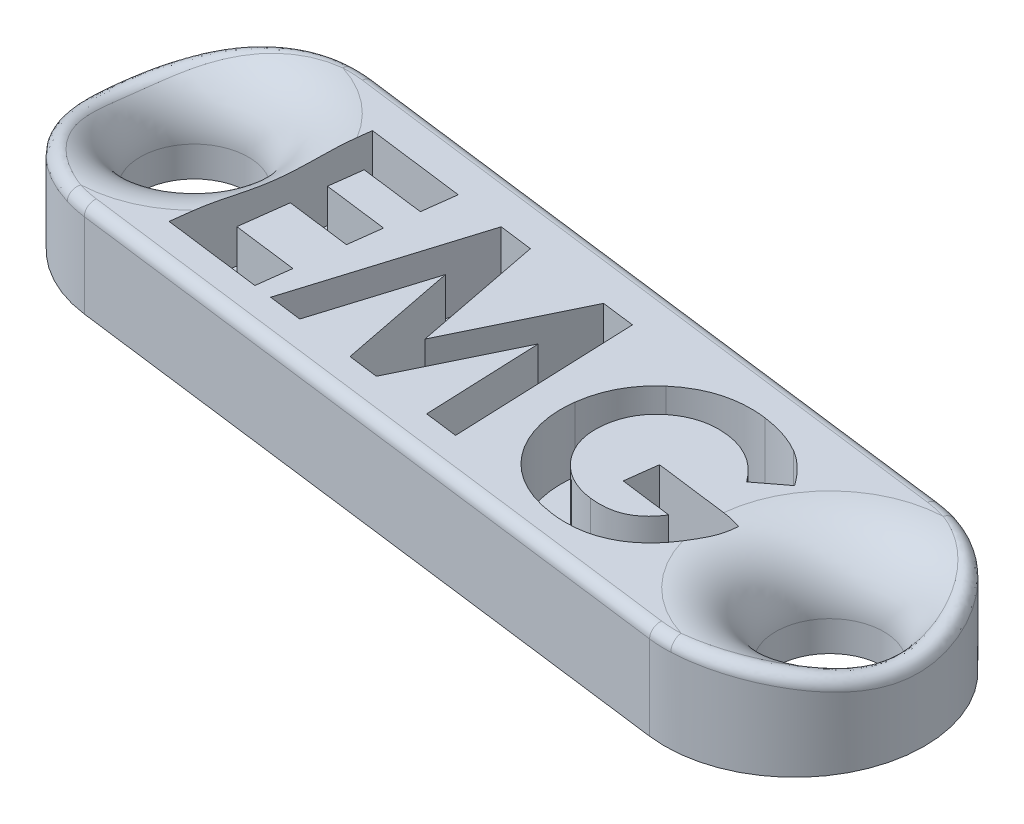
from build123d import *

# Parameters (mm, degrees)
BOSS_EXTRUDE1_DEPTH = 2.2
SKETCH3_R           = 1.25
CUT_EXTRUDE1_DEPTH  = 3
CUT_EXTRUDE2_DEPTH  = 1.5
FILLET1_R           = 1.5
FILLET7_R           = 0.25


with BuildPart() as part:
    # Sketch1 → Boss-Extrude1 (new body)
    with BuildSketch(Plane(origin=(0, 0, 0), x_dir=(1, 0, 0), z_dir=(0, 1, 0))):
        with BuildLine():
            Line((-7.119052023, 3.935857167), (7.880947977, 2.015572456))
            ThreePointArc((7.880947977, 2.015572456), (10.475714811, -1.341090333), (7.119052023, -3.935857167))
            Line((7.119052023, -3.935857167), (-7.880947977, -2.015572456))
            ThreePointArc((-7.880947977, -2.015572456), (-10.475714811, 1.341090333), (-7.119052023, 3.935857167))
        make_face()
    extrude(amount=BOSS_EXTRUDE1_DEPTH)

    # Sketch3 → Cut-Extrude1 (cut)
    with BuildSketch(Plane(origin=(0, 2.2, 0), x_dir=(1, 0, 0), z_dir=(0, 1, 0))):
        with Locations(Location((-8.431191966, 1.079352602, 0), (0, 0, 270))):
            Circle(SKETCH3_R)
        with Locations(Location((8.431191966, -1.079352602, 0), (0, 0, 270))):
            Circle(SKETCH3_R)
    extrude(amount=-CUT_EXTRUDE1_DEPTH, mode=Mode.SUBTRACT)

    # Sketch2 → Cut-Extrude2 (cut)
    with BuildSketch(Plane(origin=(0, 2.2, 0), x_dir=(1, 0, 0), z_dir=(0, 1, 0))):
        Polygon((-6.022160446, 2.793099197), (-3.745217337, 2.501379111), (-3.844436087, 1.723741558), (-5.332717337, 1.913698823), (-5.429392017, 1.159805927), (-3.941110767, 0.969848662), (-4.03863347, 0.207475532), (-5.52691472, 0.397432797), (-5.667686621, -0.699909618), (-4.179405371, -0.889866883), (-4.279472145, -1.670048506), (-6.556415254, -1.378328421), align=None)
        Polygon((-2.607180569, 2.355429305), (-1.830391039, 2.256210555), (-1.238470633, -0.77716952), (0.111582786, 2.006891645), (0.87734801, 1.909368942), (1.046104687, -2.351949167), (0.280339463, -2.254426464), (0.170096408, 0.437200138), (-1.054449533, -2.083125716), (-1.754916947, -1.993235225), (-2.294259896, 0.752664882), (-3.088009896, -1.822782501), (-3.862255355, -1.723563751), align=None)
        with BuildLine():
            Line((5.975449792, 0.564142178), (5.346216352, 0.083312851))
            add(Edge.make_bspline(
                [(5.346216352, 0.083312851), (5.307574927, 0.133842856), (5.232110059, 0.232525554), (5.10508245, 0.364899693), (4.971035347, 0.480853262), (4.828706191, 0.579946602), (4.67820433, 0.661934172), (4.520301115, 0.727428962), (4.354118953, 0.775782284), (4.239796558, 0.794036899), (4.181880081, 0.803284806)],
                knots=[0, 0, 0, 0, 1.082479837, 2.114031708, 3.117474084, 4.096195461, 5.061173401, 6.030140628, 7.002056298, 8, 8, 8, 8], degree=3))
            add(Edge.make_bspline(
                [(4.181880081, 0.803284806), (4.131338155, 0.808485041), (4.032118246, 0.81869373), (3.884415299, 0.817374988), (3.741541892, 0.803304879), (3.602915263, 0.775003934), (3.469143705, 0.733486779), (3.339594998, 0.678896355), (3.215479776, 0.60951165), (3.096961613, 0.527831982), (2.986713986, 0.436267226), (2.887358738, 0.336721443), (2.801468219, 0.229161804), (2.727315391, 0.114999554), (2.664657547, -0.006056471), (2.615822147, -0.135100273), (2.5776535, -0.270981365), (2.563427908, -0.365090604), (2.556219023, -0.412780899)],
                knots=[0, 0, 0, 0, 1.076976059, 2.114234178, 3.126640716, 4.117876873, 5.109693102, 6.092991669, 7.094043356, 8.120151584, 9.141906521, 10.129727869, 11.09792167, 12.055813259, 13.013104218, 13.982930287, 14.97784055, 16, 16, 16, 16], degree=3))
            add(Edge.make_bspline(
                [(2.556219023, -0.412780899), (2.551308987, -0.462479098), (2.54167091, -0.560033397), (2.54371017, -0.705800687), (2.559384068, -0.847396239), (2.590630115, -0.985032443), (2.634277696, -1.118665517), (2.694052433, -1.247833162), (2.766656895, -1.37350643), (2.854169687, -1.492976374), (2.951258872, -1.605016136), (3.058062639, -1.70587502), (3.1727303, -1.794413199), (3.295896042, -1.870332188), (3.426767974, -1.934242102), (3.565908249, -1.984771663), (3.712450731, -2.02484048), (3.813915161, -2.040035127), (3.865567314, -2.047770215)],
                knots=[0, 0, 0, 0, 1.025985715, 2.013942514, 2.990658298, 3.949350306, 4.910434562, 5.875183578, 6.869885119, 7.889283403, 8.914824687, 9.913743918, 10.904039322, 11.887765757, 12.883163006, 13.892507545, 14.927145989, 16, 16, 16, 16], degree=3))
            add(Edge.make_bspline(
                [(3.865567314, -2.047770215), (3.899170825, -2.051570085), (3.965395676, -2.059058762), (4.063407556, -2.063085369), (4.15800045, -2.061571815), (4.249249413, -2.054001598), (4.337009713, -2.040328269), (4.421965411, -2.021948696), (4.50306591, -1.996527313), (4.580906456, -1.964726487), (4.65599503, -1.927430216), (4.728265646, -1.883054396), (4.798026982, -1.831995515), (4.864868677, -1.774069095), (4.929656462, -1.710234736), (4.991661508, -1.639845463), (5.050029029, -1.562163962), (5.08669137, -1.507470829), (5.105377677, -1.479594467)],
                knots=[0, 0, 0, 0, 1.116708228, 2.200777012, 3.237324609, 4.23988476, 5.222331064, 6.169217582, 7.108292401, 8.025482677, 8.944097531, 9.874452197, 10.82313228, 11.796351439, 12.793287391, 13.825325763, 14.891597464, 16, 16, 16, 16], degree=3))
            Line((5.105377677, -1.479594467), (3.897792207, -1.325254189))
            Line((3.897792207, -1.325254189), (3.992770839, -0.579841529))
            Line((3.992770839, -0.579841529), (6.090780989, -0.84866498))
            Line((6.090780989, -0.84866498), (6.074668542, -1.025053869))
            add(Edge.make_bspline(
                [(6.074668542, -1.025053869), (6.06794037, -1.070393674), (6.054566986, -1.160514219), (6.023607317, -1.293074415), (5.984234522, -1.422696386), (5.937178005, -1.549950365), (5.879975916, -1.673835326), (5.814383002, -1.794696877), (5.740330164, -1.912696554), (5.65887069, -2.027415287), (5.569948807, -2.135718427), (5.477853009, -2.238382768), (5.379793486, -2.331558693), (5.277963598, -2.417537636), (5.17168882, -2.495663057), (5.061471134, -2.566403162), (4.946439452, -2.628258788), (4.827634375, -2.682782003), (4.704716332, -2.728768529), (4.577488613, -2.764864941), (4.447094295, -2.794214786), (4.312110852, -2.813338335), (4.173612933, -2.82467039), (4.03116952, -2.825499267), (3.884983925, -2.820496423), (3.786646818, -2.809134014), (3.736667741, -2.803359157)],
                knots=[0, 0, 0, 0, 1.006728493, 2.00104347, 2.987334935, 3.981727492, 4.979392329, 5.982609001, 7.001031851, 8.038497551, 9.071510868, 10.07833514, 11.066677617, 12.040790112, 13.004712617, 13.962614058, 14.915772436, 15.871799648, 16.832756477, 17.795898371, 18.775361492, 19.766976764, 20.788708185, 21.82595079, 22.895056242, 24, 24, 24, 24], degree=3))
            add(Edge.make_bspline(
                [(3.736667741, -2.803359157), (3.683387231, -2.795927273), (3.577912915, -2.781215084), (3.424010787, -2.74607379), (3.274559843, -2.706305128), (3.131586255, -2.655656252), (2.993159208, -2.59838213), (2.861512278, -2.530811404), (2.733883577, -2.457248317), (2.613465758, -2.373951436), (2.498343883, -2.284386363), (2.391863092, -2.186479946), (2.292209791, -2.08323713), (2.200975801, -1.972537364), (2.116241707, -1.856234465), (2.039704441, -1.732511338), (1.970868466, -1.602463246), (1.91026043, -1.466374198), (1.85770256, -1.326591117), (1.81557009, -1.184139251), (1.781064645, -1.040797916), (1.757322132, -0.895668723), (1.744224629, -0.749140678), (1.738652026, -0.601343752), (1.74368332, -0.452000377), (1.754493642, -0.35251912), (1.759924953, -0.302537843)],
                knots=[0, 0, 0, 0, 1.086433577, 2.150708343, 3.187110151, 4.209458027, 5.212902018, 6.211604957, 7.197040694, 8.187149235, 9.16745743, 10.141757755, 11.107178911, 12.064405515, 13.037751194, 14.012453196, 15.001193556, 16.00848233, 17.020536399, 18.016164384, 19.008050382, 19.997697579, 20.984291194, 21.978657013, 22.984438827, 24, 24, 24, 24], degree=3))
            add(Edge.make_bspline(
                [(1.759924953, -0.302537843), (1.770268101, -0.23473405), (1.790667397, -0.101007881), (1.842555137, 0.093315053), (1.909581698, 0.278975624), (1.992653822, 0.456268918), (2.093462835, 0.62360981), (2.209556731, 0.782442942), (2.341790704, 0.932532436), (2.441403991, 1.022983439), (2.491769237, 1.068716163)],
                knots=[0, 0, 0, 0, 1.034179176, 2.039661958, 3.028555554, 4.009165244, 4.988522125, 5.971207025, 6.974226627, 8, 8, 8, 8], degree=3))
            add(Edge.make_bspline(
                [(2.491769237, 1.068716163), (2.522866565, 1.09506782), (2.584334582, 1.147155385), (2.680901343, 1.218802234), (2.779983836, 1.283732627), (2.881112353, 1.343545568), (2.984617025, 1.396680164), (3.09008763, 1.444953879), (3.198630682, 1.485061685), (3.309212285, 1.52017943), (3.421942565, 1.548839048), (3.536843419, 1.571900606), (3.654050756, 1.588737289), (3.773755479, 1.600031037), (3.896073404, 1.603917467), (4.020573537, 1.602190833), (4.147378447, 1.594736211), (4.232233852, 1.584999959), (4.275162666, 1.580074336)],
                knots=[0, 0, 0, 0, 1.021269094, 2.018674626, 3.010859359, 3.988857469, 4.961504821, 5.925315747, 6.893697478, 7.859302947, 8.831743912, 9.806993135, 10.794768023, 11.797817517, 12.818496822, 13.859909119, 14.917316311, 16, 16, 16, 16], degree=3))
            add(Edge.make_bspline(
                [(4.275162666, 1.580074336), (4.320182606, 1.573744167), (4.409457736, 1.56119136), (4.541284314, 1.534482898), (4.670068385, 1.502371533), (4.795978925, 1.464519377), (4.918076968, 1.418842136), (5.038215562, 1.369219325), (5.154921095, 1.312403252), (5.230505889, 1.270327383), (5.26819819, 1.24934517)],
                knots=[0, 0, 0, 0, 1.03531603, 2.053045237, 3.061814702, 4.057784446, 5.04573047, 6.029829673, 7.017523906, 8, 8, 8, 8], degree=3))
            add(Edge.make_bspline(
                [(5.26819819, 1.24934517), (5.299558853, 1.229957783), (5.363298547, 1.190553446), (5.455187271, 1.123109723), (5.546679155, 1.049374284), (5.635133654, 0.96674353), (5.723189923, 0.877349376), (5.809028792, 0.779870994), (5.894388594, 0.675553638), (5.948103332, 0.601727473), (5.975449792, 0.564142178)],
                knots=[0, 0, 0, 0, 0.891834353, 1.812629029, 2.755912356, 3.733681732, 4.739751616, 5.791186563, 6.875481275, 8, 8, 8, 8], degree=3))
        make_face()
    extrude(amount=-CUT_EXTRUDE2_DEPTH, mode=Mode.SUBTRACT)

    # Fillet1
    # the kernel refuses this fillet: 1.5 mm, written as the material it takes off along each edge
    with BuildSketch(Plane(origin=(8.431191966, 2.2, 1.079352602), x_dir=(0, 0, 1), z_dir=(-1, 0, 0))) as fillet1_piece_1:
        with BuildLine():
            CenterArc((1.25 + FILLET1_R, -FILLET1_R), FILLET1_R, 90, 90)
            Line((1.25, -FILLET1_R), (1.25, 0))
            Line((1.25, 0), (1.25 + FILLET1_R, 0))
        make_face()
    revolve(axis=Axis((8.431191966, 2.2, 1.079352602), (0, 1, 0)), mode=Mode.SUBTRACT)
    with BuildSketch(Plane(origin=(-8.431191966, 2.2, -1.079352602), x_dir=(0, 0, 1), z_dir=(-1, 0, 0))) as fillet1_piece_2:
        with BuildLine():
            CenterArc((1.25 + FILLET1_R, -FILLET1_R), FILLET1_R, 90, 90)
            Line((1.25, -FILLET1_R), (1.25, 0))
            Line((1.25, 0), (1.25 + FILLET1_R, 0))
        make_face()
    revolve(axis=Axis((-8.431191966, 2.2, -1.079352602), (0, 1, 0)), mode=Mode.SUBTRACT)

    # Fillet7
    fillet7_edges = [part.edges().sort_by_distance(p)[0] for p in [
        (7.754143202, 2.2, 3.949358178),
        (-8.498959011, 2.2, 1.868652599),
        (8.498959011, 2.2, -1.868652599),
        (10.479138155, 2.032534441, 1.313321953),
        (-10.475714811, 2.032503738, -1.341090333),
        (0.380947977, 2.2, -2.975714811),
        (-7.754143202, 2.2, -3.949358178),
        (-0.380947977, 2.2, 2.975714811),
    ]]
    fillet(fillet7_edges, radius=FILLET7_R)


solid = part.part
